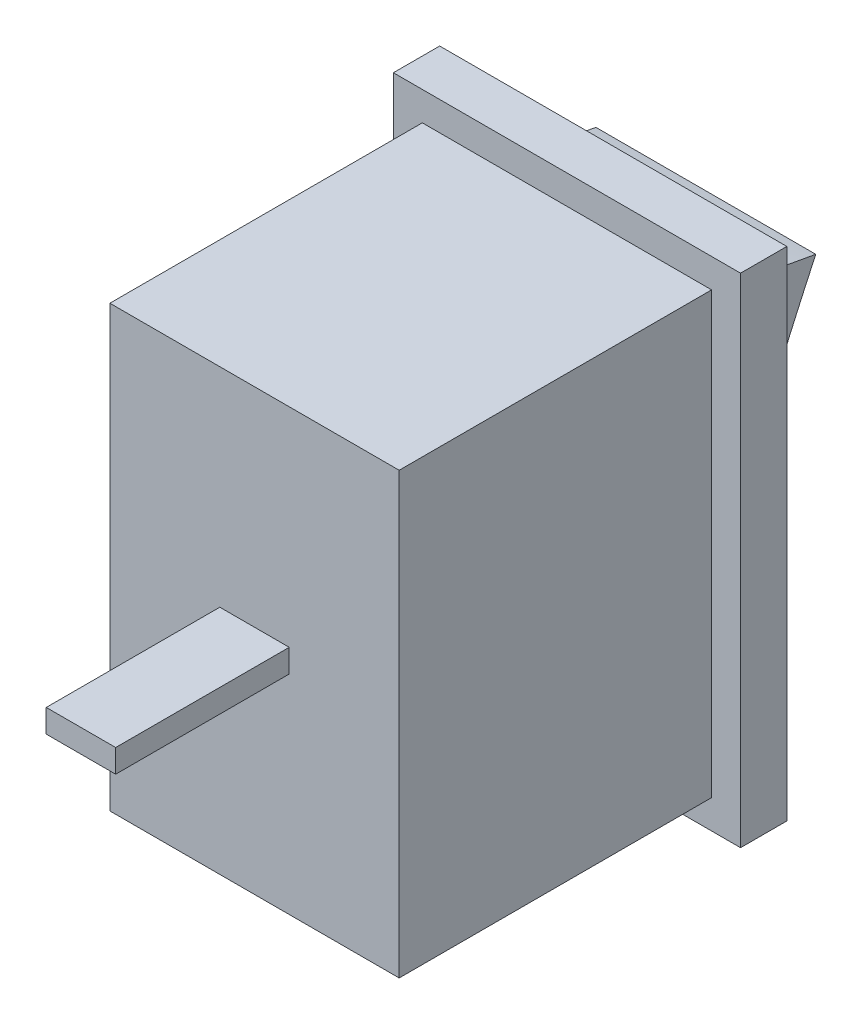
from build123d import *

# Parameters (mm, degrees)
SKETCH_1_W          = 15
SKETCH_1_H          = 21.5
EXTRUDE_1_DEPTH     = 2
SKETCH_2_W          = 12.5
SKETCH_2_H          = 19
EXTRUDE_2_DEPTH     = 13.5
SKETCH_3_W          = 9.5
SKETCH_3_H          = 15
EXTRUDE_3_DEPTH     = 4
CUT_EXTRUDE_START   = -9.5
CUT_EXTRUDE_1_DEPTH = 9.5
SKETCH_6_W          = 3
SKETCH_6_H          = 1
EXTRUDE_1_2_DEPTH   = 7.5


# Read off the part's stored shape, not the designer's step: 切除-拉伸1
with BuildPart() as part:
    # 草图1 → Extrude 1 (new body)
    with BuildSketch(Plane.XY):
        Rectangle(SKETCH_1_W, SKETCH_1_H)
    extrude(amount=EXTRUDE_1_DEPTH)

    # 草图2 → 拉伸2 (add)
    with BuildSketch(Plane.XY.offset(2)):
        Rectangle(SKETCH_2_W, SKETCH_2_H)
    extrude(amount=EXTRUDE_2_DEPTH)

    # 草图3 → 拉伸3 (add)
    with BuildSketch(Plane(origin=(0, 0, 0), x_dir=(-1, 0, 0), z_dir=(0, 0, -1))):
        Rectangle(SKETCH_3_W, SKETCH_3_H)
    extrude(amount=EXTRUDE_3_DEPTH)

    # 切除-拉伸1 outline → 切除-拉伸1 (cut)
    with BuildSketch(Plane.ZY.offset(4.75).offset(CUT_EXTRUDE_START)):
        with BuildLine():
            Line((-4, -7.5), (-0.355698538, -7.5))
            add(Edge.make_bspline(
                [(-0.355698538, -7.5), (-0.354349182, -7.203584733), (-0.342893084, -4.687006069), (-0.90591647, 0.423075599), (-2.923742076, 4.765110149), (-4, 7.081043238)],
                knots=[0, 0, 0, 0, 0.058645761, 0.497905094, 1, 1, 1, 1], degree=3))
            Line((-4, 7.081043238), (-4, -7.5))
        make_face()
        with BuildLine():
            Line((-4, 7.5), (-4, 7.081043238))
            add(Edge.make_bspline(
                [(-4, 7.081043238), (-3.418318642, 7.19501669), (-2.098267317, 7.453664838), (-0.752663012, 7.483379257), (0, 7.5)],
                knots=[0, 0, 0, 0, 0.440650562, 1, 1, 1, 1], degree=3))
            Line((0, 7.5), (-4, 7.5))
        make_face()
    extrude(amount=CUT_EXTRUDE_1_DEPTH, mode=Mode.SUBTRACT)

    # 草图6 → Extrude 1 2 (add)
    with BuildSketch(Plane.XY.offset(15.5)):
        Rectangle(SKETCH_6_W, SKETCH_6_H)
    extrude(amount=EXTRUDE_1_2_DEPTH)


solid = part.part
